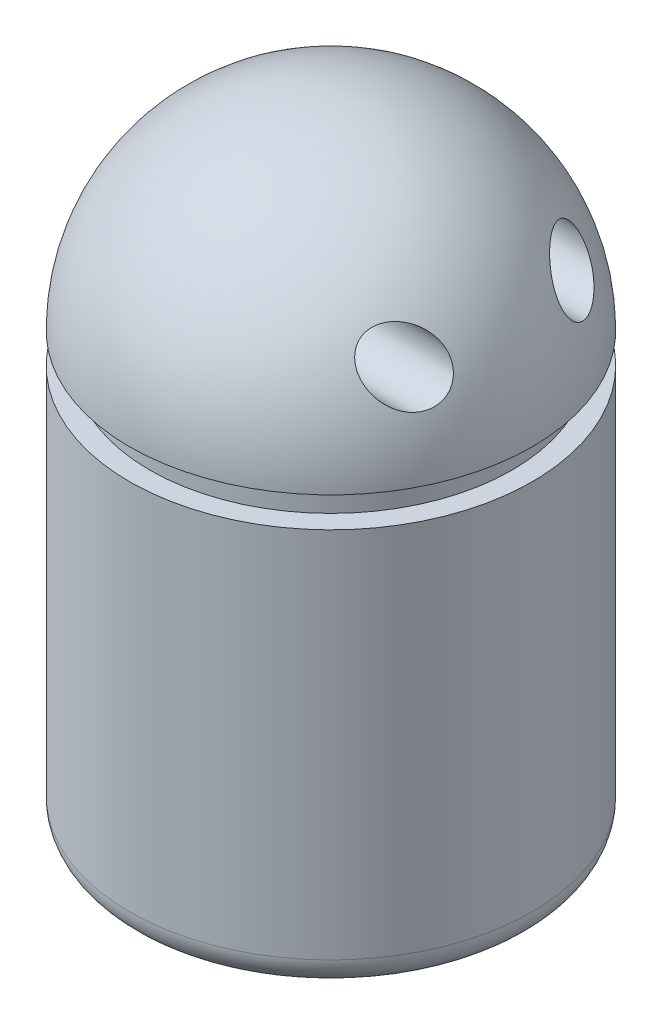
from build123d import *

# Parameters (mm, degrees)
REDONDEO3_R           = 3
CROQUIS9_R            = 3
CORTAR_EXTRUIR3_DEPTH = 18


with BuildPart() as part:
    # Croquis4 → Revolución4 (revolve)
    with BuildSketch(Plane.XY):
        with BuildLine():
            Line((20, -17.912835745), (20, 22.083900585))
            Line((20, 22.083900585), (18, 22.083900585))
            Line((18, 22.083900585), (18, 25.087164255))
            Line((18, 25.087164255), (20, 25.087164255))
            ThreePointArc((20, 25.087164255), (14.142135624, 39.229299878), (0, 45.087164255))
            Line((0, 45.087164255), (0, -17.912835745))
            Line((0, -17.912835745), (20, -17.912835745))
        make_face()
    revolve(axis=Axis((0, 45.087164255, 0), (0, -1, 0)))

    # Redondeo3
    redondeo3_edges = [part.edges().sort_by_distance(p)[0] for p in [
        (-20, -17.912835745, 0),
    ]]
    fillet(redondeo3_edges, radius=REDONDEO3_R)

    # Croquis9 → Cortar-Extruir3 (cut)
    with BuildSketch(Plane(origin=(0, 0, 0), x_dir=(0, 0, -1), z_dir=(1, 0, 0))):
        with Locations((8.261556573, 33.885616094)):
            Circle(CROQUIS9_R)
        with Locations((-8.261556573, 33.885616094)):
            Circle(CROQUIS9_R)
    extrude(amount=CORTAR_EXTRUIR3_DEPTH, mode=Mode.SUBTRACT)


solid = part.part
